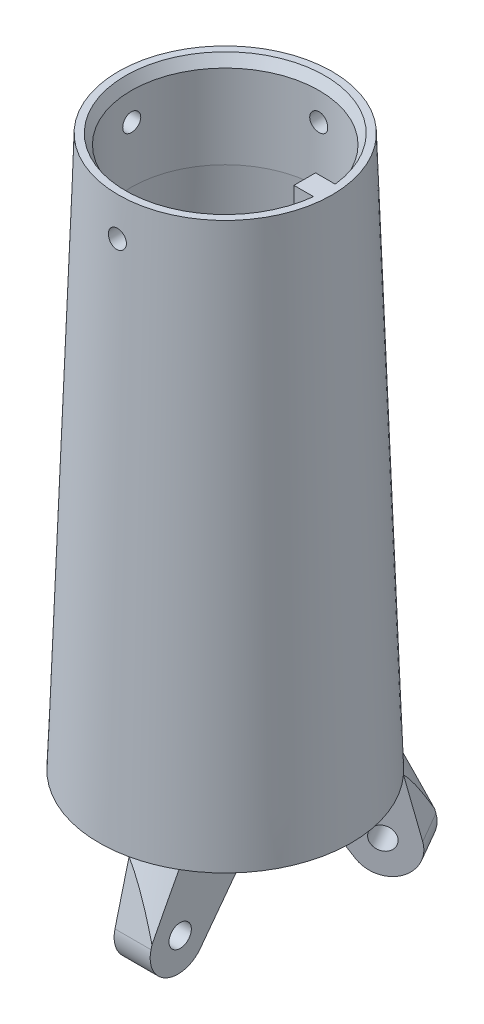
from build123d import *

# Parameters (mm, degrees)
SKETCH_1_R               = 17.5
EXTRUDE_1_DEPTH          = 200
EXTRUDE_1_TAPER          = 2
EXTRUDE_2_DEPTH          = 12.5
EXTRUDE_2_DRAFT          = -25
CUT_EXTRUDE_1_DEPTH      = 12.5
SKETCH_5_R               = 1.55
CUT_EXTRUDE_2_DEPTH      = 203.439460302
CHAMFER_1_SIZE           = 3
CHAMFER_1_SIZE2          = 3.812436427
PATTERN_CIRCULAR_2_COUNT = 3
EXTRUDE_3_DEPTH          = 13
SKETCH_12_R              = 1.25
CUT_EXTRUDE_3_DEPTH      = 82.605855603
CUT_EXTRUDE_4_DEPTH      = 82.605855603
CUT_EXTRUDE_4_DEPTH_BACK = 82.605855603
SKETCH_13_R              = 1.25
CHAMFER_3_SIZE           = 12
CHAMFER_3_SIZE2          = 6.769076267
CHAMFER_4_SIZE           = 0.8
CHAMFER_4_SIZE2          = 1.385640646


with BuildPart() as part:
    # 草图1 → 凸台-拉伸1 (new body)
    with BuildSketch(Plane(origin=(0, 0, 0), x_dir=(1, 0, 0), z_dir=(0, 1, 0))):
        Circle(SKETCH_1_R)
    extrude(amount=EXTRUDE_1_DEPTH, taper=EXTRUDE_1_TAPER)


with BuildPart() as extrude_2_tool:
    # 凸台-拉伸2: read off the stored shape, not the designer's step
    # 凸台-拉伸2 outline → 凸台-拉伸2 (with draft: the straight prism first)
    with BuildSketch(Plane.XZ.offset(12.5)):
        with BuildLine():
            Line((-2.078845727, -1.817738728), (14.578845727, -1.817738728))
            Line((14.578845727, -1.817738728), (14.578845727, 18.212421591))
            ThreePointArc((14.578845727, 18.212421591), (6.735850314, 22.335249349), (-2.078845727, 23.236037601))
            Line((-2.078845727, 23.236037601), (-2.078845727, -1.817738728))
        make_face()
    extrude(amount=-EXTRUDE_2_DEPTH)
    # 凸台-拉伸2: the draft: its side faces are tilted about the plane it starts from
    extrude_2_sides = [extrude_2_tool.faces().sort_by_distance(p)[0] for p in [
        (-2.078845727, -6.25, 10.709149437),
        (6.25, -6.25, -1.817738728),
        (14.578845727, -6.25, 8.197341431),
        (6.735850314, -6.25, 22.335249349),
    ]]
    draft(extrude_2_sides, Plane.XZ.offset(12.5), EXTRUDE_2_DRAFT)


with BuildPart() as part_1:
    add(part.part)

    # 凸台-拉伸2: add extrude_2_tool
    add(extrude_2_tool.part)

    # 草图4 → 切除-拉伸1 (cut)
    with BuildSketch(Plane.XZ.offset(12.5)):
        Polygon((8.75, 15.155444566), (8.75, 21.625737975), (8.75, 22.625737975), (15.578845727, 22.625737975), (15.578845727, -2.817738728), (8.75, -2.817738728), (8.75, 4.011106999), align=None)
        Polygon((3.75, 17.093492914), (3.75, 23.025475955), (3.75, 24.025475955), (-3.078845727, 24.025475955), (-3.078845727, -2.817738728), (3.75, -2.817738728), (3.75, 4.011106999), align=None)
    extrude(amount=-CUT_EXTRUDE_1_DEPTH, mode=Mode.SUBTRACT)

    # 草图5 → 切除-拉伸2 (cut, through all)
    with BuildSketch(Plane.ZY.offset(-3.75)):
        with Locations((15, -8)):
            Circle(SKETCH_5_R)
        with BuildLine():
            Line((4.011106999, 0), (12.214361758, -10.95327183))
            ThreePointArc((12.214361758, -10.95327183), (16.970472378, -12.122462651), (19.047673538, -7.68705616))
            Line((19.047673538, -7.68705616), (17.093492914, 0))
            Line((17.093492914, 0), (24.025475955, 0))
            Line((24.025475955, 0), (24.025475955, -13.5))
            Line((24.025475955, -13.5), (-2.817738728, -13.5))
            Line((-2.817738728, -13.5), (-2.817738728, 0))
            Line((-2.817738728, 0), (4.011106999, 0))
        make_face()
    extrude(amount=-CUT_EXTRUDE_2_DEPTH, mode=Mode.SUBTRACT)

    # 倒角1
    chamfer_1_edges = [part_1.edges().sort_by_distance(p)[0] for p in [
        (6.25, 0, 4.011106999),
    ]]
    chamfer_1_side = [part_1.faces().sort_by_distance(p)[0] for p in [
        (-0.420899726, 0, -0.691089635),
    ]]
    chamfer(chamfer_1_edges, length=CHAMFER_1_SIZE, length2=CHAMFER_1_SIZE2, reference=chamfer_1_side[0])


with BuildPart() as pattern_circular_2_1:
    # 阵列(圆周)2: pattern copy
    add(part_1.part.rotate(Axis((0, 0, 0), (0, 1, 0)), 1 * 360 / PATTERN_CIRCULAR_2_COUNT))


with BuildPart() as pattern_circular_2_2:
    # 阵列(圆周)2: pattern copy
    add(part_1.part.rotate(Axis((0, 0, 0), (0, 1, 0)), 2 * 360 / PATTERN_CIRCULAR_2_COUNT))


with BuildPart() as pattern_circular_2_1_1:
    add(pattern_circular_2_1.part)

    # Combine 1: read off the stored shape, not the designer's step
    # Combine 1: union 阵列(圆周)2_2, part
    add(pattern_circular_2_2.part)
    add(part_1.part)

    # 草图10 → 切除-旋转1 (revolve, cut)
    with BuildSketch(Plane(origin=(0, 0, 0), x_dir=(0, 0, -1), z_dir=(1, 0, 0))):
        Polygon((0, 2), (15.629061281, 2), (13.027463954, 63.5), (13.027463954, 76.5), (23.027463954, 76.5), (23.027463954, 210), (0, 210), align=None)
    revolve(axis=Axis((0, 0, 0), (0, 1, 0)), mode=Mode.SUBTRACT)

    # 草图11 → 凸台-拉伸3 (add)
    with BuildSketch(Plane(origin=(0, 76.5, 0), x_dir=(1, 0, 0), z_dir=(0, 1, 0))):
        Polygon((13.928012544, 0), (13.928012544, -1.5), (11.027463954, -1.5), (11.027463954, 1.5), (13.928012544, 1.5), align=None)
    extrude(amount=-EXTRUDE_3_DEPTH)

    # 草图12 → 切除-拉伸3 (cut, through all)
    with BuildSketch(Plane(origin=(0, 0, 0), x_dir=(0, 0, -1), z_dir=(1, 0, 0))):
        with Locations((0, 71.31)):
            Circle(SKETCH_12_R)
    extrude(amount=-CUT_EXTRUDE_3_DEPTH, mode=Mode.SUBTRACT)

    # 草图13 → 切除-拉伸4 (cut, two sides: drawn at the far end of the back side and taken through both)
    with BuildSketch(Plane.XY.offset(-CUT_EXTRUDE_4_DEPTH_BACK)):
        with Locations((0, 71.31)):
            Circle(SKETCH_13_R)
    extrude(amount=CUT_EXTRUDE_4_DEPTH + CUT_EXTRUDE_4_DEPTH_BACK, mode=Mode.SUBTRACT)

    # 倒角3
    chamfer_3_edges = [pattern_circular_2_1_1.edges().sort_by_distance(p)[0] for p in [
        (0, 2, 15.629061281),
    ]]
    chamfer_3_side = [pattern_circular_2_1_1.faces().sort_by_distance(p)[0] for p in [
        (0, 2, 0),
    ]]
    chamfer(chamfer_3_edges, length=CHAMFER_3_SIZE, length2=CHAMFER_3_SIZE2, reference=chamfer_3_side[0])

    # 倒角4
    chamfer_4_edges = [pattern_circular_2_1_1.edges().sort_by_distance(p)[0] for p in [
        (-13.027463954, 76.5, 0),
    ]]
    chamfer_4_side = [pattern_circular_2_1_1.faces().sort_by_distance(p)[0] for p in [
        (7.204573044, 76.5, 12.47868656),
    ]]
    chamfer(chamfer_4_edges, length=CHAMFER_4_SIZE, length2=CHAMFER_4_SIZE2, reference=chamfer_4_side[0])


solid = pattern_circular_2_1_1.part
